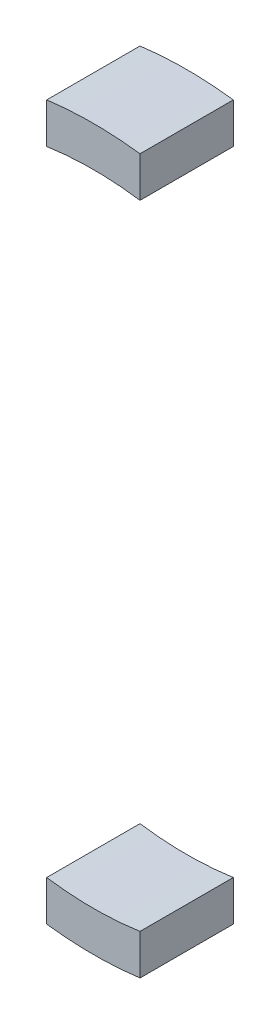
from build123d import *

# Parameters (mm, degrees)
BOSS_EXTRU_1_DEPTH   = 3.5
BOSS_EXTRU_1_2_DEPTH = 3.5


with BuildPart() as part:
    # Esquisse1 → Boss.-Extru.1 (new body)
    with BuildSketch(Plane.XY):
        with BuildLine():
            Line((1.75, 13.38609353), (1.75, 11.871710071))
            ThreePointArc((1.75, 11.871710071), (0, 12), (-1.75, 11.871710071))
            Line((-1.75, 11.871710071), (-1.75, 13.38609353))
            ThreePointArc((-1.75, 13.38609353), (0, 13.5), (1.75, 13.38609353))
        make_face()
    extrude(amount=BOSS_EXTRU_1_DEPTH)


with BuildPart() as body_2:
    # Esquisse1 → Boss.-Extru.1 2 (new body)
    with BuildSketch(Plane.XY):
        with BuildLine():
            Line((-1.75, -11.871710071), (-1.75, -13.38609353))
            ThreePointArc((-1.75, -13.38609353), (0, -13.5), (1.75, -13.38609353))
            Line((1.75, -13.38609353), (1.75, -11.871710071))
            ThreePointArc((1.75, -11.871710071), (0, -12), (-1.75, -11.871710071))
        make_face()
    extrude(amount=BOSS_EXTRU_1_2_DEPTH)


solid = Compound([part.part, body_2.part])
